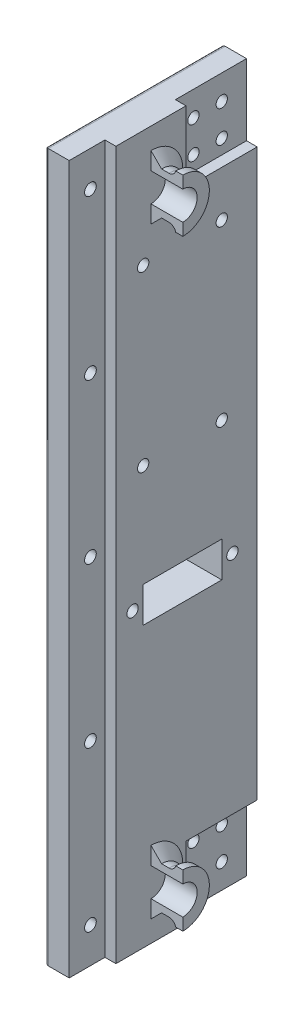
from build123d import *

# Parameters (mm, degrees)
SKETCH2_W           = 50
SKETCH2_H           = 200
BOSS_EXTRUDE2_DEPTH = 10
SKETCH4_R           = 6
BOSS_EXTRUDE3_DEPTH = 7
SKETCH5_R           = 7.5
BOSS_EXTRUDE4_DEPTH = 2
SKETCH8_W           = 20.1
SKETCH8_H           = 20.1
CUT_EXTRUDE4_DEPTH  = 3
SKETCH9_R           = 1.6
CUT_EXTRUDE5_DEPTH  = 129.570250184
CUT_EXTRUDE8_REACH  = 131.411
SKETCH10_W          = 20
SKETCH10_H          = 23.413423022
SKETCH10_H_2        = 20.071314626
SKETCH11_R          = 4.05
CUT_EXTRUDE9_DEPTH  = 9
SKETCH12_R          = 1.6
CUT_EXTRUDE10_DEPTH = 129.399023487
FILLET2_R           = 2
FILLET3_R           = 1
CHAMFER1_SIZE       = 3
SKETCH14_R          = 1.65
CUT_EXTRUDE12_DEPTH = 130.411395296
SKETCH15_W          = 3.1
SKETCH15_H          = 10.1
CUT_EXTRUDE13_DEPTH = 206.006939607
SKETCH16_W          = 22.2
SKETCH16_H          = 10
CUT_EXTRUDE14_DEPTH = 10
SKETCH17_R          = 1.6
CUT_EXTRUDE15_DEPTH = 130.411395296
SKETCH18_R          = 1.6
CUT_EXTRUDE16_DEPTH = 129.570250184
SKETCH19_R          = 1.6
CUT_EXTRUDE17_DEPTH = 129.570250184


with BuildPart() as part:
    # Sketch2 → Boss-Extrude2 (new body)
    with BuildSketch(Plane(origin=(0, 0, 0), x_dir=(0, 0, -1), z_dir=(1, 0, 0))):
        with Locations((-15.827016632, 21.323797935)):
            Rectangle(SKETCH2_W, SKETCH2_H)
    extrude(amount=BOSS_EXTRUDE2_DEPTH)

    # Sketch4 → Boss-Extrude3 (add)
    with BuildSketch(Plane(origin=(10, 0, 0), x_dir=(0, 0, -1), z_dir=(1, 0, 0))):
        with Locations((-20.827016632, 106.323797935)):
            Circle(SKETCH4_R)
        with Locations((-20.827016632, -63.676202065)):
            Circle(SKETCH4_R)
    extrude(amount=BOSS_EXTRUDE3_DEPTH)

    # Sketch5 → Boss-Extrude4 (add)
    with BuildSketch(Plane(origin=(17, 0, 0), x_dir=(0, 0, -1), z_dir=(1, 0, 0))):
        with Locations((-20.827016632, -63.676202065)):
            Circle(SKETCH5_R)
        with Locations((-20.827016632, 106.323797935)):
            Circle(SKETCH5_R)
    extrude(amount=BOSS_EXTRUDE4_DEPTH)

    # Sketch8 → Cut-Extrude4 (cut)
    with BuildSketch(Plane(origin=(10, 0, 0), x_dir=(0, 0, -1), z_dir=(1, 0, 0))):
        with Locations((-0.877016632, -68.626202065)):
            Rectangle(SKETCH8_W, SKETCH8_H)
        with Locations((-0.877016632, 111.273797935)):
            Rectangle(SKETCH8_W, SKETCH8_H)
    extrude(amount=-CUT_EXTRUDE4_DEPTH, mode=Mode.SUBTRACT)

    # Sketch9 → Cut-Extrude5 (cut, through all)
    with BuildSketch(Plane(origin=(7, 0, 0), x_dir=(0, 0, -1), z_dir=(1, 0, 0))):
        with Locations((-5.827016632, 114.323797935)):
            Circle(SKETCH9_R)
        with Locations((2.172983368, 105.323797935)):
            Circle(SKETCH9_R)
        with Locations((2.172983368, 114.323797935)):
            Circle(SKETCH9_R)
        with Locations((-5.827016632, -71.676202065)):
            Circle(SKETCH9_R)
        with Locations((2.172983368, -62.676202065)):
            Circle(SKETCH9_R)
        with Locations((2.172983368, -71.676202065)):
            Circle(SKETCH9_R)
    extrude(amount=-CUT_EXTRUDE5_DEPTH, mode=Mode.SUBTRACT)

    # Cut-Extrude8: up to this face of the body (flat: up to its plane)
    cut_extrude8_end = Plane(part.part.faces().sort_by_distance((10, 21.323797935, 17.048206438))[0])
    # Sketch10 → Cut-Extrude8 (cut, up to the picked face)
    with BuildSketch(Plane(origin=(19, 0, 0), x_dir=(0, 0, -1), z_dir=(1, 0, 0)), mode=Mode.PRIVATE) as cut_extrude8_sk1:
        with Locations((-30.827016632, -63.1074113)):
            Rectangle(SKETCH10_W, SKETCH10_H)
    cut_extrude8_tool1 = split(extrude(cut_extrude8_sk1.sketch, amount=-CUT_EXTRUDE8_REACH, mode=Mode.PRIVATE), bisect_by=cut_extrude8_end, keep=Keep.BOTH, mode=Mode.PRIVATE)
    # Sketch10 → Cut-Extrude8 (cut, up to the picked face)
    with BuildSketch(Plane(origin=(19, 0, 0), x_dir=(0, 0, -1), z_dir=(1, 0, 0)), mode=Mode.PRIVATE) as cut_extrude8_sk2:
        with Locations((-30.827016632, 105.037131871)):
            Rectangle(SKETCH10_W, SKETCH10_H_2)
    cut_extrude8_tool2 = split(extrude(cut_extrude8_sk2.sketch, amount=-CUT_EXTRUDE8_REACH, mode=Mode.PRIVATE), bisect_by=cut_extrude8_end, keep=Keep.BOTH, mode=Mode.PRIVATE)
    add(cut_extrude8_tool1.solids().sort_by(Axis((19, -63.107411, 30.827017), (-1, 0, 0)))[0], mode=Mode.SUBTRACT)
    add(cut_extrude8_tool2.solids().sort_by(Axis((19, 105.037132, 30.827017), (-1, 0, 0)))[0], mode=Mode.SUBTRACT)

    # Sketch11 → Cut-Extrude9 (cut)
    with BuildSketch(Plane(origin=(19, 0, 0), x_dir=(0, 0, -1), z_dir=(1, 0, 0))):
        with Locations((-20.827016632, -63.676202065)):
            Circle(SKETCH11_R)
        with Locations((-20.827016632, 106.323797935)):
            Circle(SKETCH11_R)
    extrude(amount=-CUT_EXTRUDE9_DEPTH, mode=Mode.SUBTRACT)

    # Sketch12 → Cut-Extrude10 (cut, through all)
    with BuildSketch(Plane(origin=(10, 0, 0), x_dir=(0, 0, -1), z_dir=(1, 0, 0))):
        with Locations((-23.027016632, 39.323797935)):
            Circle(SKETCH12_R)
        with Locations((-23.027016632, 88.323797935)):
            Circle(SKETCH12_R)
        with Locations((-0.827016632, 88.323797935)):
            Circle(SKETCH12_R)
        with Locations((-0.827016632, 39.323797935)):
            Circle(SKETCH12_R)
    extrude(amount=-CUT_EXTRUDE10_DEPTH, mode=Mode.SUBTRACT)

    # Fillet2
    # the kernel refuses this fillet: 2 mm, written as the material it adds along each edge
    with BuildSketch(Plane(origin=(17, 106.323797935, 20.827016632), x_dir=(0, 1, 0), z_dir=(0, 0, 1))) as fillet2_piece_1:
        with BuildLine():
            CenterArc((8, 1.936491673), FILLET2_R, 180, 75.522487814)
            Line((7.5, 0), (7.49, -0.038729833))
            ThreePointArc((7.49, -0.038729833), (6.75, -0.04), (6, -0.04))
            Line((6, -0.04), (5.96, 0))
            Line((5.96, 0), (5.96, 1.936491673))
            Line((5.96, 1.936491673), (6, 1.936491673))
        make_face()
    revolve(axis=Axis((17, 106.323797935, 20.827016632), (-1, 0, 0)), revolution_arc=180)
    with BuildSketch(Plane(origin=(17, -63.676202065, 20.827016632), x_dir=(0, -1, 0), z_dir=(0, 0, 1))) as fillet2_piece_2:
        with BuildLine():
            CenterArc((8, -1.936491673), FILLET2_R, 104.477512186, 75.522487814)
            Line((6, -1.936491673), (5.96, -1.936491673))
            Line((5.96, -1.936491673), (5.96, 0))
            Line((5.96, 0), (6, 0.04))
            ThreePointArc((6, 0.04), (6.75, 0.04), (7.49, 0.038729833))
            Line((7.49, 0.038729833), (7.5, 0))
        make_face()
    revolve(axis=Axis((17, -63.676202065, 20.827016632), (1, 0, 0)), revolution_arc=180)

    # Fillet3
    fillet3_edges = [part.edges().sort_by_distance(p)[0] for p in [
        (0, 121.323797935, 15.827016632),
        (0, 21.323797935, -9.172983368),
        (0, -78.676202065, 15.827016632),
        (0, 21.323797935, 40.827016632),
    ]]
    fillet(fillet3_edges, radius=FILLET3_R)

    # Chamfer1
    chamfer1_edges = [part.edges().sort_by_distance(p)[0] for p in [
        (10, -63.676202065, 14.827016632),
        (10, 106.323797935, 14.827016632),
    ]]
    chamfer(chamfer1_edges, length=CHAMFER1_SIZE)

    # Sketch14 → Cut-Extrude12 (cut, through all)
    with BuildSketch(Plane.ZY):
        with Locations((34.827016632, 111.323797935)):
            Circle(SKETCH14_R)
        with Locations((34.827016632, 66.323797935)):
            Circle(SKETCH14_R)
        with Locations((34.827016632, 21.323797935)):
            Circle(SKETCH14_R)
        with Locations((34.827016632, -23.676202065)):
            Circle(SKETCH14_R)
        with Locations((34.827016632, -68.676202065)):
            Circle(SKETCH14_R)
    extrude(amount=-CUT_EXTRUDE12_DEPTH, mode=Mode.SUBTRACT)

    # Sketch15 → Cut-Extrude13 (cut, through all)
    with BuildSketch(Plane.XZ.offset(78.676202065)):
        with Locations((8.45, 35.777016632)):
            Rectangle(SKETCH15_W, SKETCH15_H)
    extrude(amount=-CUT_EXTRUDE13_DEPTH, mode=Mode.SUBTRACT)

    # Sketch16 → Cut-Extrude14 (cut)
    with BuildSketch(Plane(origin=(10, 0, 0), x_dir=(0, 0, -1), z_dir=(1, 0, 0))):
        with Locations((-11.927016632, 5.273797935)):
            Rectangle(SKETCH16_W, SKETCH16_H)
    extrude(amount=-CUT_EXTRUDE14_DEPTH, mode=Mode.SUBTRACT)

    # Sketch17 → Cut-Extrude15 (cut, through all)
    with BuildSketch(Plane.ZY):
        with Locations((26.027016632, 5.273797935)):
            Circle(SKETCH17_R)
        with Locations((-2.172983368, 5.273797935)):
            Circle(SKETCH17_R)
    extrude(amount=-CUT_EXTRUDE15_DEPTH, mode=Mode.SUBTRACT)

    # Sketch18 → Cut-Extrude16 (cut, through all)
    with BuildSketch(Plane(origin=(7, 0, 0), x_dir=(0, 0, -1), z_dir=(1, 0, 0))):
        with Locations((-5.827016632, -62.676202065)):
            Circle(SKETCH18_R)
    extrude(amount=-CUT_EXTRUDE16_DEPTH, mode=Mode.SUBTRACT)

    # Sketch19 → Cut-Extrude17 (cut, through all)
    with BuildSketch(Plane(origin=(7, 0, 0), x_dir=(0, 0, -1), z_dir=(1, 0, 0))):
        with Locations((-5.827016632, 105.323797935)):
            Circle(SKETCH19_R)
    extrude(amount=-CUT_EXTRUDE17_DEPTH, mode=Mode.SUBTRACT)


solid = part.part
